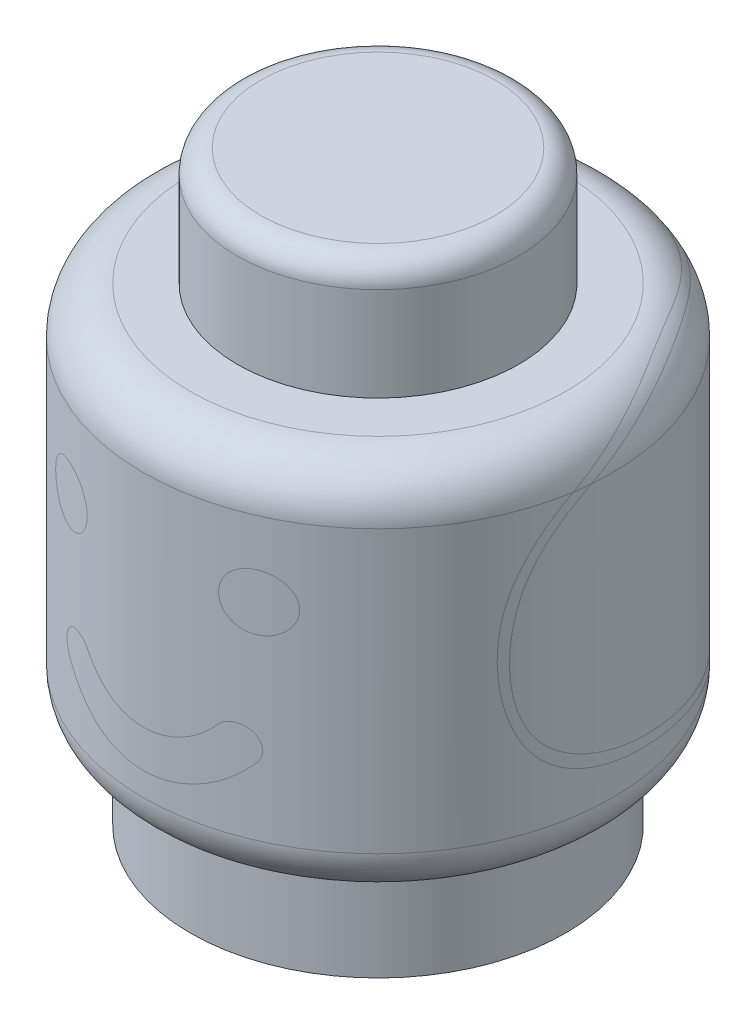
from build123d import *

# Parameters (mm, degrees)
SKETCH1_R        = 5
HEAD_DEPTH       = 8
SKETCH3_R        = 4
NECK_DEPTH       = 2
SKETCH6_R        = 3
HEAD_KNOB_DEPTH  = 2.5
HEAD_HOLE_D      = 6
HEAD_HOLE_DEPTH  = 5
HEAD_HOLE_TIP    = 1.802581857
HEAD_ROUNDNESS_R = 1
EADY_INSERT_R    = 0.5
SCALE1_SCALE     = 2


with BuildPart() as part:
    # Sketch1 → Head (new body)
    with BuildSketch(Plane(origin=(0, 0, 0), x_dir=(1, 0, 0), z_dir=(0, 1, 0))):
        with Locations(Location((0, 0, 0), (0, 0, 270))):
            Circle(SKETCH1_R)
    extrude(amount=HEAD_DEPTH)

    # Sketch3 → Neck (add)
    with BuildSketch(Plane(origin=(0, 0, 0), x_dir=(1, 0, 0), z_dir=(0, 1, 0))):
        with Locations(Location((0, 0, 0), (0, 0, 270))):
            Circle(SKETCH3_R)
    extrude(amount=-NECK_DEPTH)

    # Sketch6 → Head knob (add)
    with BuildSketch(Plane(origin=(0, 8, 0), x_dir=(1, 0, 0), z_dir=(0, 1, 0))):
        with Locations(Location((0, 0, 0), (0, 0, 270))):
            Circle(SKETCH6_R)
    extrude(amount=HEAD_KNOB_DEPTH)

    # Head hole
    with Locations(Plane(origin=(0, -2, 0), x_dir=(-1, 0, 0), z_dir=(0, -1, 0))):
        with Locations((0, 0)):
            Hole(HEAD_HOLE_D / 2, depth=HEAD_HOLE_DEPTH)
            with Locations((0, 0, -(HEAD_HOLE_DEPTH + HEAD_HOLE_TIP / 2))):  # 118° drill point
                Cone(0, HEAD_HOLE_D / 2, HEAD_HOLE_TIP, mode=Mode.SUBTRACT)

    # Head roundness
    head_roundness_edges = [part.edges().sort_by_distance(p)[0] for p in [
        (0, 0, -5),
        (0, 8, -5),
    ]]
    fillet(head_roundness_edges, radius=HEAD_ROUNDNESS_R - 0.0001)  # a hair under: the kernel refuses the full size

    # Eady insert
    eady_insert_edges = [part.edges().sort_by_distance(p)[0] for p in [
        (0, 10.5, -3),
    ]]
    fillet(eady_insert_edges, radius=EADY_INSERT_R)


with BuildPart() as part_1:
    # Scale1: scaled about (0, 4.58400844, 0)
    add(part.part.scale(SCALE1_SCALE).moved(Location((0, -4.58400844, 0))))


solid = part_1.part
